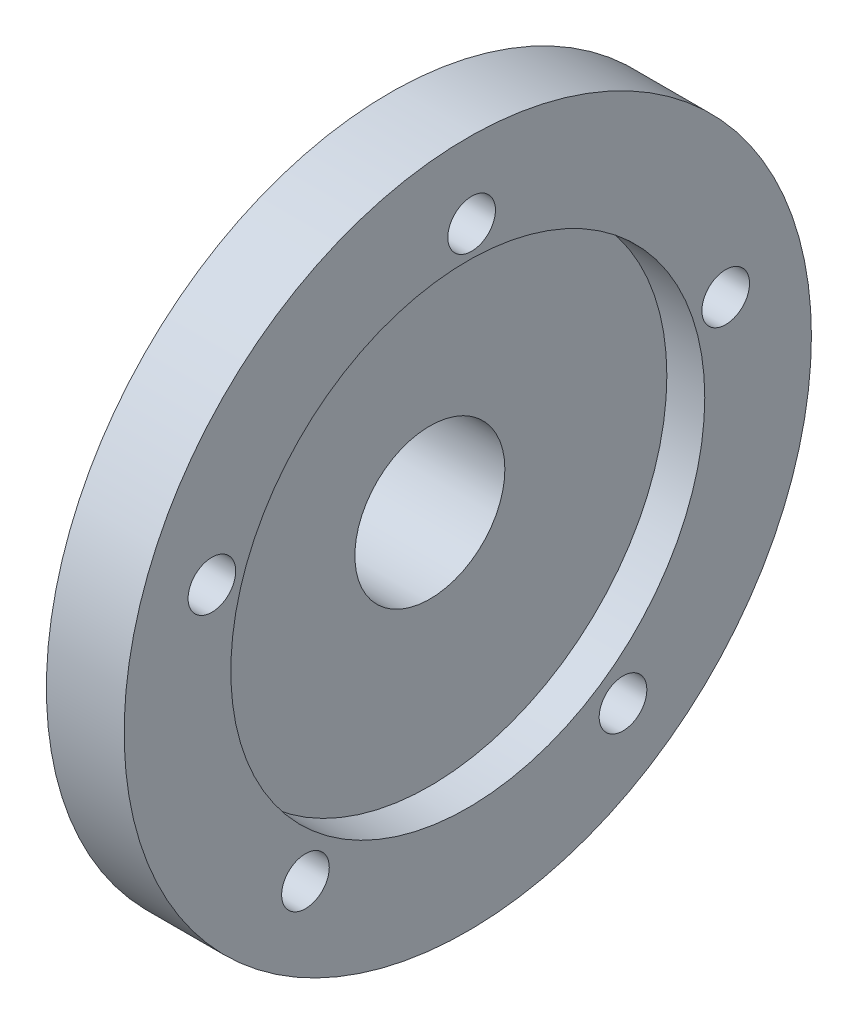
from build123d import *

# Parameters (mm, degrees)
SKETCH2_R          = 2.5527
CUT_EXTRUDE1_DEPTH = 56.074558476


with BuildPart() as part:
    # Sketch1 → Revolve1 (revolve)
    with BuildSketch(Plane.XY):
        Polygon((-27.857278892, 8.0391), (-14.024094998, 8.0391), (-14.024094998, 25.4), (-9.960094998, 25.4), (-9.960094998, 36.83), (-18.295757287, 36.83), (-27.857278892, 17.801339222), align=None)
    revolve(axis=Axis((0, 0, 0), (-1, 0, 0)))

    # Sketch2 → Cut-Extrude1 (cut, through all)
    with BuildSketch(Plane(origin=(-9.960094998, 0, 0), x_dir=(0, 0, -1), z_dir=(1, 0, 0))):
        with Locations((16.63743279, -24.006277019)):
            Circle(SKETCH2_R)
        with Locations((-17.398499411, -23.491852194)):
            Circle(SKETCH2_R)
        with Locations((0.411085097, 28.626849497)):
            Circle(SKETCH2_R)
        with Locations((27.644361341, 8.204852076)):
            Circle(SKETCH2_R)
        with Locations((-27.426933798, 9.037208927)):
            Circle(SKETCH2_R)
    extrude(amount=-CUT_EXTRUDE1_DEPTH, mode=Mode.SUBTRACT)


solid = part.part
